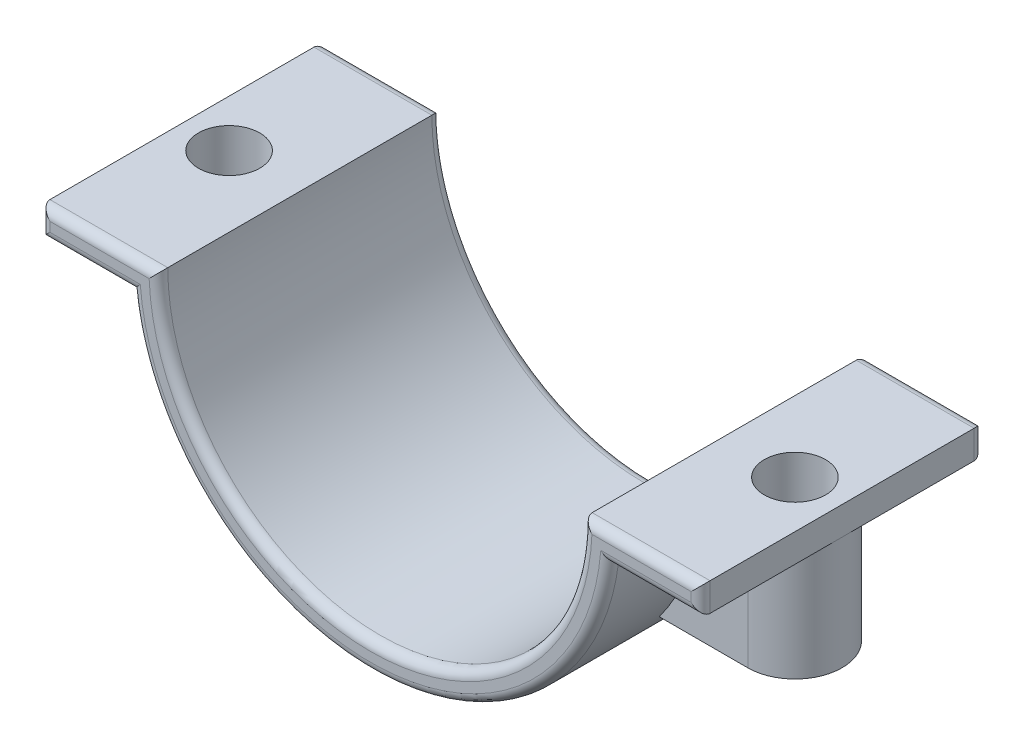
from build123d import *

# Parameters (mm, degrees)
BOSS_EXTRUDE1_DEPTH = 15
BOSS_EXTRUDE5_REACH = 58.23
BOSS_EXTRUDE5_START = 12
SKETCH4_5_R         = 3.25
CUT_EXTRUDE1_DEPTH  = 45.229515032
FILLET1_R           = 1


with BuildPart() as part:
    # Sketch1 → Boss-Extrude1 (new, symmetric)
    with BuildSketch(Plane.XY):
        with BuildLine():
            Line((-35, 0), (-22.5, 0))
            ThreePointArc((-22.5, 0), (0, -22.5), (22.5, 0))
            Line((22.5, 0), (35, 0))
            Line((35, 0), (35, -3))
            Line((35, -3), (25.322914524, -3))
            ThreePointArc((25.322914524, -3), (0, -25.5), (-25.322914524, -3))
            Line((-25.322914524, -3), (-35, -3))
            Line((-35, -3), (-35, 0))
        make_face()
    extrude(amount=BOSS_EXTRUDE1_DEPTH, both=True)

    # Sketch4 → Boss-Extrude5 (add, up to next)
    with BuildSketch(Plane.XZ.offset(3).offset(BOSS_EXTRUDE5_START), mode=Mode.PRIVATE) as boss_extrude5_sk1:
        with BuildLine():
            Line((20.645829048, 5), (20.645829048, -5))
            Line((20.645829048, -5), (30, -5))
            ThreePointArc((30, -5), (35, 0), (30, 5))
            Line((30, 5), (20.645829048, 5))
        make_face()
    boss_extrude5_tool1 = extrude(boss_extrude5_sk1.sketch, amount=-BOSS_EXTRUDE5_REACH, mode=Mode.PRIVATE) - part.part
    boss_extrude5 = boss_extrude5_tool1.solids().sort_by_distance((27.333296, -15, 0))[0]
    add(boss_extrude5)

    # Sketch4<5> → Cut-Extrude1 (cut, symmetric)
    with BuildSketch(Plane.XZ.offset(3)):
        with Locations((30, 0)):
            Circle(SKETCH4_5_R)
    cut_extrude1 = extrude(amount=CUT_EXTRUDE1_DEPTH, both=True, mode=Mode.SUBTRACT)

    # Mirror1: Boss-Extrude5, Cut-Extrude1 across plane
    add(boss_extrude5.mirror(Plane(origin=(0, 0, 0), x_dir=(0, 0, 1), z_dir=(1, 0, 0))))
    add(cut_extrude1.mirror(Plane(origin=(0, 0, 0), x_dir=(0, 0, 1), z_dir=(1, 0, 0))), mode=Mode.SUBTRACT)

    # Fillet1
    fillet1_edges = [part.edges().sort_by_distance(p)[0] for p in [
        (28.75, 0, 15),
        (35, -1.5, 15),
        (30.161457262, -3, 15),
        (0, -25.5, 15),
        (-30.161457262, -3, 15),
        (-35, -1.5, 15),
        (-28.75, 0, 15),
        (0, -22.5, 15),
        (-28.75, 0, -15),
        (-35, -1.5, -15),
        (-30.161457262, -3, -15),
        (0, -25.5, -15),
        (30.161457262, -3, -15),
        (35, -1.5, -15),
        (28.75, 0, -15),
        (0, -22.5, -15),
    ]]
    fillet(fillet1_edges, radius=FILLET1_R)


solid = part.part
